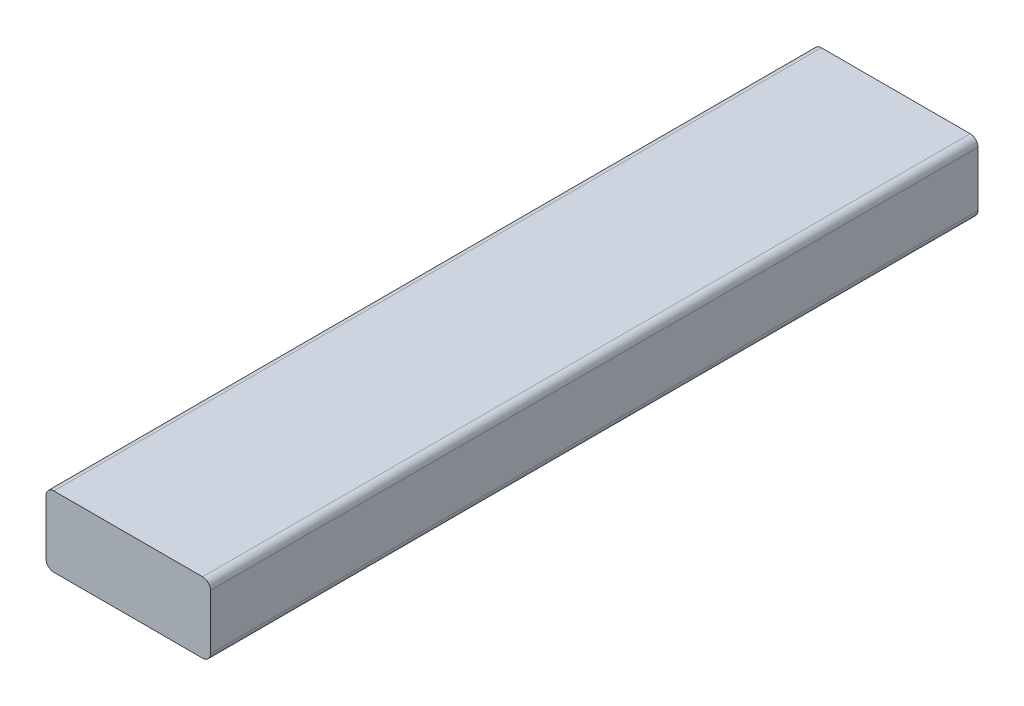
from build123d import *

# Parameters (mm, degrees)
SKETCH1_W           = 42
SKETCH1_H           = 18
BOSS_EXTRUDE1_DEPTH = 196
FILLET1_R           = 2


with BuildPart() as part:
    # Sketch1 → Boss-Extrude1 (new body)
    with BuildSketch(Plane.XY):
        with Locations((21, 9)):
            Rectangle(SKETCH1_W, SKETCH1_H)
    extrude(amount=BOSS_EXTRUDE1_DEPTH)

    # Fillet1
    fillet1_edges = [part.edges().sort_by_distance(p)[0] for p in [
        (0, 0, 98),
        (42, 0, 98),
        (42, 18, 98),
        (0, 18, 98),
    ]]
    fillet(fillet1_edges, radius=FILLET1_R)


solid = part.part
